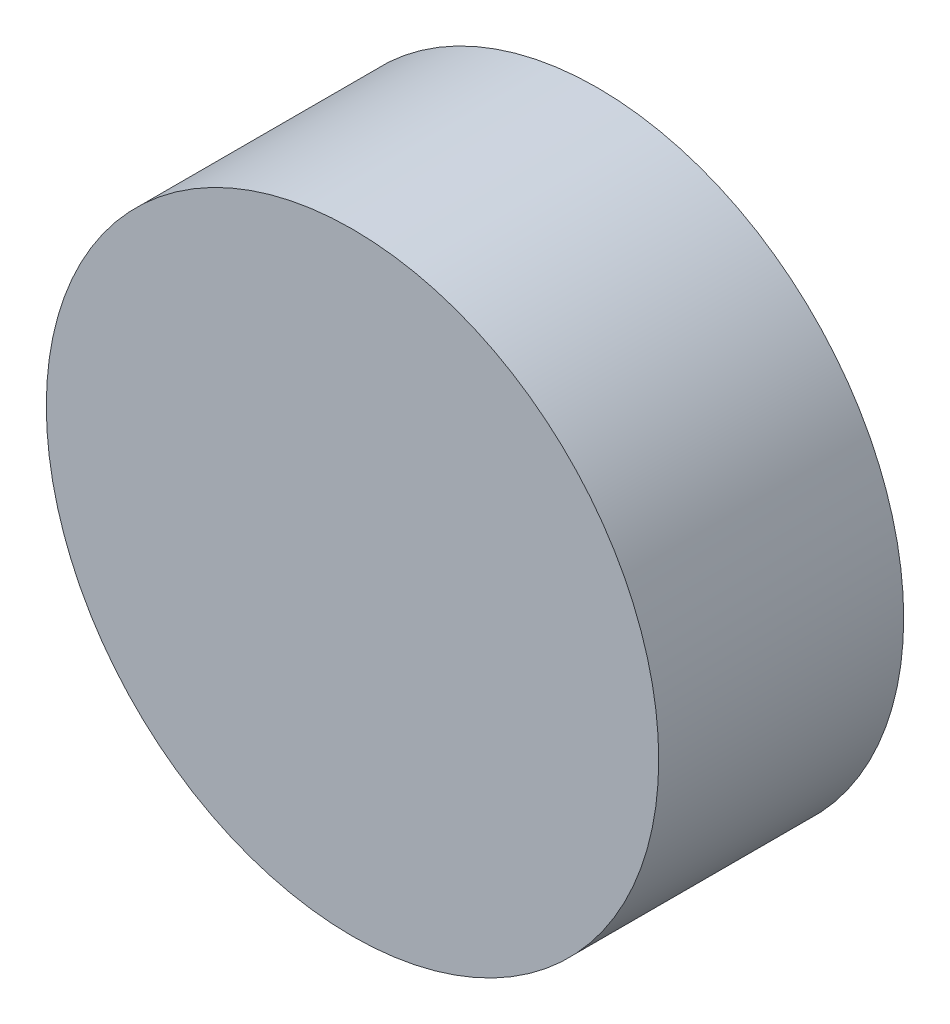
from build123d import *

# Parameters (mm, degrees)
SKETCH_1_W            = 10
SKETCH_1_H            = 8
CUT_EXTRUDE_928_DEPTH = 6
CHAMFER_1_SIZE        = 1


with BuildPart() as part:
    # Эскиз1 → Повернуть1 (revolve)
    with BuildSketch(Plane(origin=(0, 0, 0), x_dir=(1, 0, 0), z_dir=(0, 1, 0))):
        with Locations((-5, -4)):
            Rectangle(SKETCH_1_W, SKETCH_1_H)
    revolve(axis=Axis((0, 0, 10.353242845), (0, 0, -1)))

    # Эскиз2 → Cut-Extrude 928 (cut)
    with BuildSketch(Plane(origin=(0, 0, 0), x_dir=(-1, 0, 0), z_dir=(0, 0, -1))):
        with BuildLine():
            Line((1.374772708, -1), (-1.374772708, -1))
            ThreePointArc((-1.374772708, -1), (0, 1.7), (1.374772708, -1))
        make_face()
    extrude(amount=-CUT_EXTRUDE_928_DEPTH, mode=Mode.SUBTRACT)

    # Фаска1
    chamfer_1_edges = [part.edges().sort_by_distance(p)[0] for p in [
        (0, 1.7, 0),
        (0, -1, 0),
    ]]
    chamfer(chamfer_1_edges, length=CHAMFER_1_SIZE)


solid = part.part
